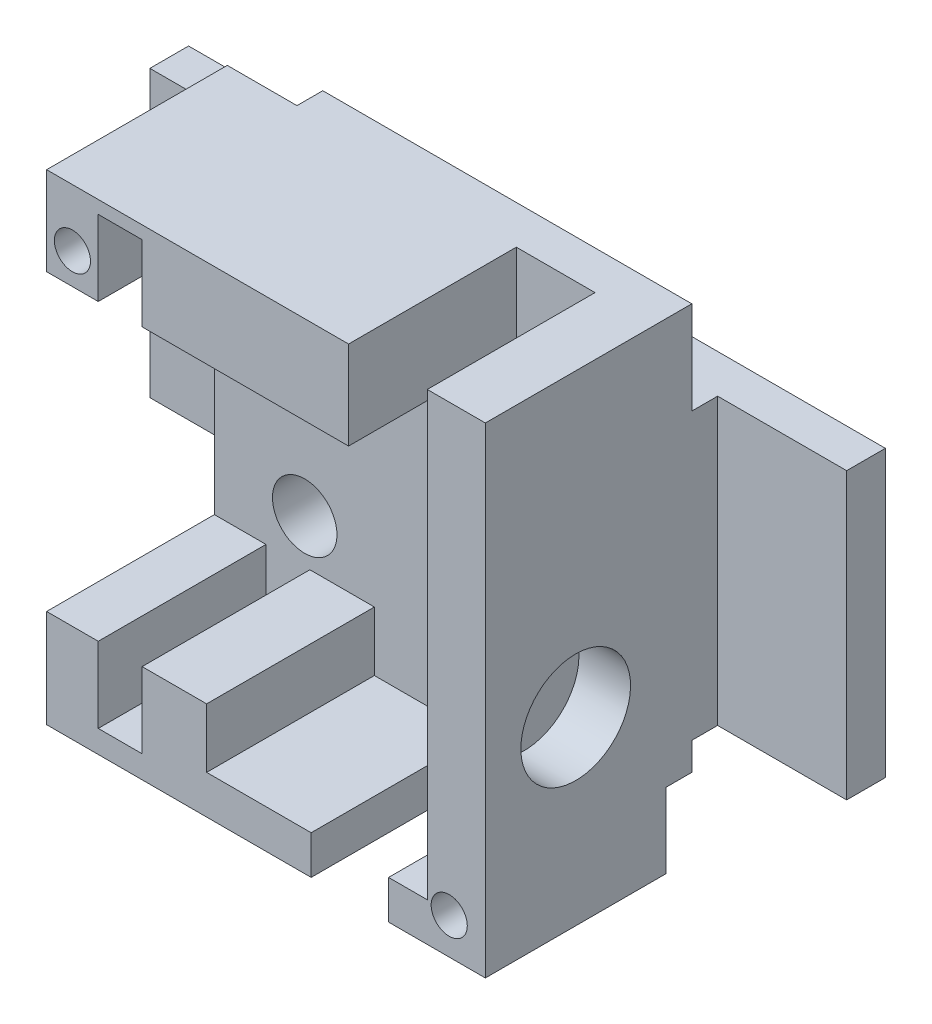
from build123d import *
from build123d.topology import SkipClean

# Parameters (mm, degrees)
SKETCH1_W                = 34
SKETCH1_H                = 38
BOSS_EXTRUDE1_DEPTH      = 16
SKETCH2_W                = 22.4
SKETCH2_H                = 22.8
SKETCH2_W_2              = 2.4
SKETCH2_H_2              = 4.85
CUT_EXTRUDE1_DEPTH       = 13
CUT_EXTRUDE2_DEPTH       = 13
SKETCH4_R                = 1.4
CUT_EXTRUDE3_DEPTH       = 31.099833887
CUT_EXTRUDE5_START       = -2
SKETCH5_R                = 1.4
CUT_EXTRUDE5_DEPTH       = 2
SKETCH7_W                = 34
SKETCH7_H                = 1
CUT_EXTRUDE6_DEPTH       = 45.598206242
CUT_EXTRUDE9_DEPTH       = 30.580398915
CUT_EXTRUDE10_DEPTH      = 29.178005607
CUT_EXTRUDE10_DEPTH_BACK = 2
SKETCH10_R               = 2.5
SKETCH11_W               = 5
SKETCH11_H               = 4.5
CUT_EXTRUDE11_DEPTH      = 12
SKETCH12_W               = 1
SKETCH12_H               = 4.85
SKETCH12_H_2             = 22.8
CUT_EXTRUDE12_DEPTH      = 12
SKETCH14_R               = 4.25
CUT_EXTRUDE13_DEPTH      = 4
SKETCH17_W               = 3.4
SKETCH17_H               = 1
CUT_EXTRUDE16_DEPTH      = 12
SKETCH18_R               = 1.4
CUT_EXTRUDE17_DEPTH      = 12
BOSS_EXTRUDE2_DEPTH      = 16
BOSS_EXTRUDE3_START      = 1
SKETCH20_R               = 1.4
BOSS_EXTRUDE3_DEPTH      = 1
SKETCH21_W               = 6.1
SKETCH21_H               = 23.876697272
CUT_EXTRUDE18_DEPTH      = 13
BOSS_EXTRUDE4_DEPTH      = 10
SKETCH23_W               = 6.1
SKETCH23_H               = 6.85
CUT_EXTRUDE19_DEPTH      = 13
SKETCH26_W               = 1.2
SKETCH26_H               = 2
CUT_EXTRUDE21_DEPTH      = 2
SKETCH27_W               = 54
SKETCH27_H               = 22.100909166
SKETCH27_R               = 1.4
BOSS_EXTRUDE6_DEPTH      = 5
SKETCH28_W               = 10
SKETCH28_H               = 22.450454583
CUT_EXTRUDE22_DEPTH      = 5
SKETCH29_R               = 3.4
SKETCH29_R_2             = 1.4
CUT_EXTRUDE23_DEPTH      = 7
SKETCH30_R               = 2.5
SKETCH30_R_2             = 1.4
CUT_EXTRUDE24_DEPTH      = 3
SKETCH31_W               = 6
SKETCH31_H               = 3
CUT_EXTRUDE25_DEPTH      = 13


with BuildPart() as part:
    # Sketch1 → Boss-Extrude1 (new body)
    with BuildSketch(Plane.XY):
        Rectangle(SKETCH1_W, SKETCH1_H)
    extrude(amount=BOSS_EXTRUDE1_DEPTH)

    # Sketch2 → Cut-Extrude1 (cut)
    with BuildSketch(Plane.XY.offset(16)):
        with Locations((-5.8, 0)):
            Rectangle(SKETCH2_W, SKETCH2_H)
        with Locations((-11.8, -13.825)):
            Rectangle(SKETCH2_W_2, SKETCH2_H_2)
        with Locations((-11.8, 13.825)):
            Rectangle(SKETCH2_W_2, SKETCH2_H_2)
    extrude(amount=-CUT_EXTRUDE1_DEPTH, mode=Mode.SUBTRACT)

    # Sketch3 → Cut-Extrude2 (cut)
    with BuildSketch(Plane.XY.offset(16)):
        Polygon((-4.6, -16), (11.4, -16), (11.4, 19), (8.4, 19), (8.4, -11.4), (-4.6, -11.4), align=None)
    extrude(amount=-CUT_EXTRUDE2_DEPTH, mode=Mode.SUBTRACT)

    # Sketch4 → Cut-Extrude3 (cut, through all)
    with BuildSketch(Plane.XY.offset(16)):
        with Locations((-15, 13.8)):
            Circle(SKETCH4_R)
        with Locations((14.2, -16.2)):
            Circle(SKETCH4_R)
    extrude(amount=-CUT_EXTRUDE3_DEPTH, mode=Mode.SUBTRACT)

    # Sketch5 → Cut-Extrude5 (cut)
    # profile 1 of 2: a face of its own
    with BuildSketch(Plane(origin=(0, 0, 0), x_dir=(-1, 0, 0), z_dir=(0, 0, -1)).offset(CUT_EXTRUDE5_START)):
        with BuildLine():
            Line((18.4, 13.8), (18.4, 19))
            Line((18.4, 19), (11.6, 19))
            Line((11.6, 19), (11.6, 13.8))
            ThreePointArc((11.6, 13.8), (15, 10.4), (18.4, 13.8))
        make_face()
        with Locations((15, 13.8)):
            Circle(SKETCH5_R, mode=Mode.SUBTRACT)
    # profile 2 of 2: a face of its own
    with BuildSketch(Plane(origin=(0, 0, 0), x_dir=(-1, 0, 0), z_dir=(0, 0, -1)).offset(CUT_EXTRUDE5_START)):
        with BuildLine():
            Line((-13.122967039, -19), (-10.2, -19))
            Line((-10.2, -19), (-10.2, -13.2))
            Line((-10.2, -13.2), (-17, -13.2))
            Line((-17, -13.2), (-17, -15.122967039))
            ThreePointArc((-17, -15.122967039), (-17.2, -16.2), (-17, -17.277032961))
            Line((-17, -17.277032961), (-17, -19.2))
            Line((-17, -19.2), (-14.2, -19.2))
            ThreePointArc((-14.2, -19.2), (-13.652277442, -19.149576241), (-13.122967039, -19))
        make_face()
        with Locations((-14.2, -16.2)):
            Circle(SKETCH5_R, mode=Mode.SUBTRACT)
    extrude(amount=CUT_EXTRUDE5_DEPTH, mode=Mode.SUBTRACT)

    # Sketch7 → Cut-Extrude6 (cut, through all)
    with BuildSketch(Plane(origin=(0, 19, 0), x_dir=(1, 0, 0), z_dir=(0, 1, 0))):
        with Locations((0, -15.5)):
            Rectangle(SKETCH7_W, SKETCH7_H)
    extrude(amount=-CUT_EXTRUDE6_DEPTH, mode=Mode.SUBTRACT)

    # Sketch9 → Cut-Extrude9 (cut, through all)
    with BuildSketch(Plane.XY.offset(15)):
        Polygon((-17, 19), (-17, 18.25), (-9, 18.25), (-9, 12.5), (13.4, 12.5), (13.4, 1), (17, 1), (17, 19), align=None)
        Polygon((-14, -12.4), (-17, -12.4), (-17, -19), (11.4, -19), (11.4, -17), (-5.6, -17), (-5.6, -12.4), (-8.6, -12.4), (-8.6, -18.25), (-14, -18.25), align=None)
    extrude(amount=-CUT_EXTRUDE9_DEPTH, mode=Mode.SUBTRACT)

    # Sketch10 → Cut-Extrude10 (cut, two sides: drawn at the far end of the back side and taken through both)
    with BuildSketch(Plane.XY.offset(3).offset(-CUT_EXTRUDE10_DEPTH_BACK)):
        with Locations((-10, 8)):
            Circle(SKETCH10_R)
        with Locations((10, 8)):
            Circle(SKETCH10_R)
        with Locations((-10, -8)):
            Circle(SKETCH10_R)
        with Locations((10, -8)):
            Circle(SKETCH10_R)
    extrude(amount=CUT_EXTRUDE10_DEPTH + CUT_EXTRUDE10_DEPTH_BACK, mode=Mode.SUBTRACT)

    # Sketch11 → Cut-Extrude11 (cut)
    with BuildSketch(Plane.XY.offset(15)):
        Polygon((12.5, -8), (7.5, -8), (7.5, -11.4), (11.4, -11.4), (11.4, -16), (12.5, -16), (12.5, -11.4), align=None)
        with Locations((10, 10.25)):
            Rectangle(SKETCH11_W, SKETCH11_H)
    extrude(amount=-CUT_EXTRUDE11_DEPTH, mode=Mode.SUBTRACT)

    # Sketch12 → Cut-Extrude12 (cut)
    with BuildSketch(Plane.XY.offset(15)):
        with Locations((-10.1, 13.825)):
            Rectangle(SKETCH12_W, SKETCH12_H)
        with Locations((-10.1, -13.825)):
            Rectangle(SKETCH12_W, SKETCH12_H)
        with Locations((5.9, 0)):
            Rectangle(SKETCH12_W, SKETCH12_H_2)
    extrude(amount=-CUT_EXTRUDE12_DEPTH, mode=Mode.SUBTRACT)

    # Sketch14 → Cut-Extrude13 (cut)
    with BuildSketch(Plane(origin=(17, 0, 0), x_dir=(0, 0, -1), z_dir=(1, 0, 0))):
        with Locations((-9, -5)):
            Circle(SKETCH14_R)
    extrude(amount=-CUT_EXTRUDE13_DEPTH, mode=Mode.SUBTRACT)

    # Sketch17 → Cut-Extrude16 (cut)
    with BuildSketch(Plane.XY.offset(15)):
        with Locations((-11.3, 16.75)):
            Rectangle(SKETCH17_W, SKETCH17_H)
        with Locations((-11.3, -16.75)):
            Rectangle(SKETCH17_W, SKETCH17_H)
    extrude(amount=-CUT_EXTRUDE16_DEPTH, mode=Mode.SUBTRACT)

    # Sketch18 → Cut-Extrude17 (cut)
    with BuildSketch(Plane.XY.offset(1)):
        with Locations((-10, 8)):
            Circle(SKETCH18_R)
        with Locations((10, 8)):
            Circle(SKETCH18_R)
        with Locations((-10, -8)):
            Circle(SKETCH18_R)
        with Locations((10, -8)):
            Circle(SKETCH18_R)
    extrude(amount=-CUT_EXTRUDE17_DEPTH, mode=Mode.SUBTRACT)

    # Sketch19 → Boss-Extrude2 (add)
    with BuildSketch(Plane.XY):
        Polygon((17, 18.25), (-9, 18.25), (-9, 12.476697272), (13.4, 12.476697272), (13.4, 1), (17, 1), align=None)
        Polygon((-14, -12.4), (-17, -12.4), (-17, -19), (11.4, -19), (11.4, -17), (-5.6, -17), (-5.6, -12.4), (-8.6, -12.4), (-8.6, -18.25), (-14, -18.25), align=None)
    extrude(amount=BOSS_EXTRUDE2_DEPTH)

    # Sketch20 → Boss-Extrude3 (add)
    # profile 1 of 2: a face of its own
    with BuildSketch(Plane.XY.offset(15).offset(BOSS_EXTRUDE3_START)):
        Polygon((-17, 18.25), (-17, 11.4), (-13, 11.4), (-13, 17.25), (-9.6, 17.25), (-9.6, 11.4), (6.4, 11.4), (6.4, -11.4), (7.5, -11.4), (7.5, 12.476697272), (-9, 12.476697272), (-9, 18.25), align=None)
        with Locations((-15, 13.8)):
            Circle(SKETCH20_R, mode=Mode.SUBTRACT)
    # profile 2 of 2: a face of its own
    with BuildSketch(Plane.XY.offset(15).offset(BOSS_EXTRUDE3_START)):
        Polygon((-13, -11.4), (-17, -11.4), (-17, -12.4), (-14, -12.4), (-14, -18.25), (-8.6, -18.25), (-8.6, -12.4), (-5.6, -12.4), (-5.6, -17), (11.4, -17), (11.4, -19), (17, -19), (17, 1), (13.4, 1), (13.4, 12.476697272), (12.5, 12.476697272), (12.5, -16), (-4.6, -16), (-4.6, -11.4), (-9.6, -11.4), (-9.6, -17.25), (-13, -17.25), align=None)
        with Locations((14.2, -16.2)):
            Circle(SKETCH20_R, mode=Mode.SUBTRACT)
    extrude(amount=-BOSS_EXTRUDE3_DEPTH)

    # Sketch21 → Cut-Extrude18 (cut)
    with BuildSketch(Plane.XY.offset(16)):
        with Locations((9.45, 0.538348636)):
            Rectangle(SKETCH21_W, SKETCH21_H)
    extrude(amount=-CUT_EXTRUDE18_DEPTH, mode=Mode.SUBTRACT)

    # Sketch22 → Boss-Extrude4 (add)
    with BuildSketch(Plane.ZY.offset(17)):
        Polygon((2, 11.050454583), (0, 11.050454583), (0, -11.4), (3, -11.4), (3, 11.050454583), align=None)
    boss_extrude4 = extrude(amount=BOSS_EXTRUDE4_DEPTH)

    # Mirror1: Boss-Extrude4 across plane
    add(boss_extrude4.mirror(Plane(origin=(0, 0, 0), x_dir=(0, 0, 1), z_dir=(1, 0, 0))))

    # Sketch23 → Cut-Extrude19 (cut)
    with BuildSketch(Plane.XY.offset(16)):
        with Locations((9.45, 14.825)):
            Rectangle(SKETCH23_W, SKETCH23_H)
    extrude(amount=-CUT_EXTRUDE19_DEPTH, mode=Mode.SUBTRACT)

    # Sketch26 → Cut-Extrude21 (cut)
    with BuildSketch(Plane(origin=(0, 0, 0), x_dir=(-1, 0, 0), z_dir=(0, 0, -1))):
        with Locations((-10.8, -18)):
            Rectangle(SKETCH26_W, SKETCH26_H)
    extrude(amount=-CUT_EXTRUDE21_DEPTH, mode=Mode.SUBTRACT)

    # Sketch27 → Boss-Extrude6 (add)
    with SkipClean():  # the faces are left unmerged after this step: merging them gives an invalid solid
        with BuildSketch(Plane(origin=(0, 0, 0), x_dir=(-1, 0, 0), z_dir=(0, 0, -1))):
            Rectangle(SKETCH27_W, SKETCH27_H)
            with Locations((-10, 8)):
                Circle(SKETCH27_R, mode=Mode.SUBTRACT)
            with Locations((-10, -8)):
                Circle(SKETCH27_R, mode=Mode.SUBTRACT)
            with Locations((10, -8)):
                Circle(SKETCH27_R, mode=Mode.SUBTRACT)
            with Locations((10, 8)):
                Circle(SKETCH27_R, mode=Mode.SUBTRACT)
        extrude(amount=BOSS_EXTRUDE6_DEPTH)

    # Sketch28 → Cut-Extrude22 (cut)
    with SkipClean():  # the faces are left unmerged after this step: merging them gives an invalid solid
        with BuildSketch(Plane.XY.offset(3)):
            with Locations((-22, -0.174772708)):
                Rectangle(SKETCH28_W, SKETCH28_H)
            with Locations((22, -0.174772708)):
                Rectangle(SKETCH28_W, SKETCH28_H)
        extrude(amount=-CUT_EXTRUDE22_DEPTH, mode=Mode.SUBTRACT)

    # Sketch29 → Cut-Extrude23 (cut)
    with SkipClean():  # the faces are left unmerged after this step: merging them gives an invalid solid
        with BuildSketch(Plane(origin=(0, 0, 2), x_dir=(-1, 0, 0), z_dir=(0, 0, -1))):
            with Locations((15, 13.8)):
                Circle(SKETCH29_R)
            with Locations((15, 13.8)):
                Circle(SKETCH29_R_2, mode=Mode.SUBTRACT)
        extrude(amount=CUT_EXTRUDE23_DEPTH, mode=Mode.SUBTRACT)

    # Sketch30 → Cut-Extrude24 (cut)
    # profile 1 of 4: a face of its own
    with BuildSketch(Plane.XY.offset(1)):
        with Locations((-10, 8)):
            Circle(SKETCH30_R)
        with Locations((-10, 8)):
            Circle(SKETCH30_R_2, mode=Mode.SUBTRACT)
    # profile 2 of 4: a face of its own
    with BuildSketch(Plane.XY.offset(1)):
        with Locations((-10, -8)):
            Circle(SKETCH30_R)
        with Locations((-10, -8)):
            Circle(SKETCH30_R_2, mode=Mode.SUBTRACT)
    # profile 3 of 4: a face of its own
    with BuildSketch(Plane.XY.offset(1)):
        with Locations((10, -8)):
            Circle(SKETCH30_R)
        with Locations((10, -8)):
            Circle(SKETCH30_R_2, mode=Mode.SUBTRACT)
    # profile 4 of 4: a face of its own
    with BuildSketch(Plane.XY.offset(1)):
        with Locations((10, 8)):
            Circle(SKETCH30_R)
        with Locations((10, 8)):
            Circle(SKETCH30_R_2, mode=Mode.SUBTRACT)
    extrude(amount=-CUT_EXTRUDE24_DEPTH, mode=Mode.SUBTRACT)

    # Sketch31 → Cut-Extrude25 (cut)
    with BuildSketch(Plane.XY.offset(16)):
        with Locations((6.5, -17.5)):
            Rectangle(SKETCH31_W, SKETCH31_H)
    extrude(amount=-CUT_EXTRUDE25_DEPTH, mode=Mode.SUBTRACT)


solid = part.part
